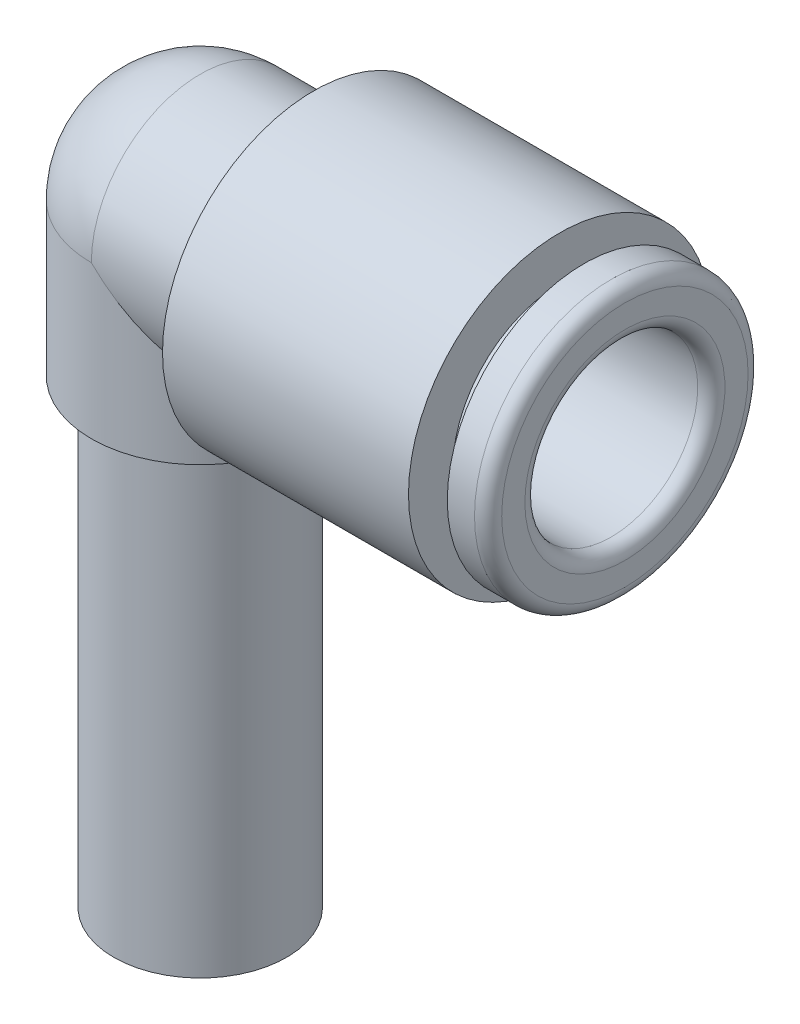
from build123d import *

# Parameters (mm, degrees)
SKETCH1_R             = 4
BASE_EXTRUDE_DEPTH    = 3.6
RBODY_SKETCH_R        = 5.55
RBODY_DEPTH           = 9.6
ELBOW_ANGLE           = 90
SKETCH3_R             = 4
BOSS_EXTRUDE1_DEPTH   = 5.6
STEM_SKETCH_R         = 3.175
STEM_DEPTH            = 17.2
RTUBE_START           = -13.3
RTUBE_SKETCH_R        = 3.175
RTUBE_DEPTH           = 13.3
RTUBE_RADIUS_R        = 0.5
DIAMETER_R            = 1.5875
PORT_THREADS_REACH    = 34.831
PORT_THREADS_SKETCH_R = 1.5875


with BuildPart() as part:
    # Sketch1 → Base-Extrude (new body)
    with BuildSketch(Plane(origin=(0, 0, 0), x_dir=(0, 0, -1), z_dir=(1, 0, 0))):
        with Locations(Location((0, 0, 0), (0, 0, 180))):
            Circle(SKETCH1_R)
    extrude(amount=BASE_EXTRUDE_DEPTH)

    # RBody_Sketch → RBody (add)
    with BuildSketch(Plane(origin=(3.6, 0, 0), x_dir=(0, 0, -1), z_dir=(1, 0, 0))):
        Circle(RBODY_SKETCH_R)
    extrude(amount=RBODY_DEPTH)

    # RBody_Chamfer: read off the stored shape, not the designer's step
    # RBody_Chamfer outline → RBody_Chamfer (revolve, cut)
    with BuildSketch(Plane.YX):
        Polygon((5.55, 4.164153863), (4, 3.6), (5.55, 3.6), align=None)
    revolve(axis=Axis((0, 0, 0), (1, 0, 0)), mode=Mode.SUBTRACT)

    # RRelease_Sketch → RRelease (revolve)
    with BuildSketch(Plane.XY, mode=Mode.PRIVATE) as rrelease_sk:
        with BuildLine():
            Line((13.2, 3.925), (14.1, 3.925))
            Line((14.1, 3.925), (14.1, 5.025))
            Line((14.1, 5.025), (15.1, 5.025))
            ThreePointArc((15.1, 5.025), (15.453553391, 4.878553391), (15.6, 4.525))
            Line((15.6, 4.525), (15.6, 0))
            Line((15.6, 0), (13.2, 0))
            Line((13.2, 0), (13.2, 3.925))
        make_face()
    revolve(rrelease_sk.sketch.rotate(Axis((12.597722381, 0, 0), (1, 0, 0)), 90), axis=Axis((12.597722381, 0, 0), (1, 0, 0)))

    # Elbow_Sketch → Elbow (revolve)
    with BuildSketch(Plane.ZY):
        with BuildLine():
            Line((-4, 0), (4, 0))
            ThreePointArc((4, 0), (0, 4), (-4, 0))
        make_face()
    revolve(axis=Axis((0, 0, -6.487672297), (0, 0, 1)), revolution_arc=ELBOW_ANGLE)

    # Sketch3 → Boss-Extrude1 (add)
    with BuildSketch(Plane.XZ):
        with Locations(Location((0, 0, 0), (0, 0, 90))):
            Circle(SKETCH3_R)
    extrude(amount=BOSS_EXTRUDE1_DEPTH)

    # Stem_Sketch → Stem (add)
    with BuildSketch(Plane(origin=(0, -5.6, 0), x_dir=(-1, 0, 0), z_dir=(0, 1, 0))):
        with Locations(Location((0, 0, 0), (0, 0, 90))):
            Circle(STEM_SKETCH_R)
    extrude(amount=-STEM_DEPTH)

    # RTube_Sketch → RTube (cut)
    with BuildSketch(Plane(origin=(15.6, 0, 0), x_dir=(0, 0, -1), z_dir=(1, 0, 0)).offset(RTUBE_START)):
        Circle(RTUBE_SKETCH_R)
    extrude(amount=RTUBE_DEPTH, mode=Mode.SUBTRACT)

    # RTube_Radius
    rtube_radius_edges = [part.edges().sort_by_distance(p)[0] for p in [
        (15.6, 0, 3.175),
    ]]
    fillet(rtube_radius_edges, radius=RTUBE_RADIUS_R)

    # Stem_Chamfer: read off the stored shape, not the designer's step
    # Stem_Chamfer outline → Stem_Chamfer (revolve, cut)
    with BuildSketch(Plane.XY):
        Polygon((3.175, -22.511324865), (2.675, -22.8), (3.175, -22.8), align=None)
    revolve(axis=Axis((0, 0, 0), (0, 1, 0)), mode=Mode.SUBTRACT)

    # Port_Curve: sweep along a path in Profile
    with BuildLine(Plane.XY) as port_curve_path:
        ThreePointArc((2.3, 0), (0.673654403, -0.673654403), (0, -2.3))
    # Diameter → Port_Curve (sweep, cut)
    with BuildSketch(Plane(origin=(2.3, 0, 0), x_dir=(0, 0, -1), z_dir=(1, 0, 0))):
        Circle(DIAMETER_R)
    sweep(path=port_curve_path.line, mode=Mode.SUBTRACT)

    # Port_Threads_Sketch → Port_Threads (cut, up to next)
    with BuildSketch(Plane(origin=(0, -22.8, 0), x_dir=(-1, 0, 0), z_dir=(0, 1, 0)), mode=Mode.PRIVATE) as port_threads_sk1:
        Circle(PORT_THREADS_SKETCH_R)
    port_threads_tool1 = extrude(port_threads_sk1.sketch, amount=PORT_THREADS_REACH, mode=Mode.PRIVATE) & part.part
    add(port_threads_tool1.solids().sort_by_distance((0, -22.8, 0))[0], mode=Mode.SUBTRACT)


solid = part.part
